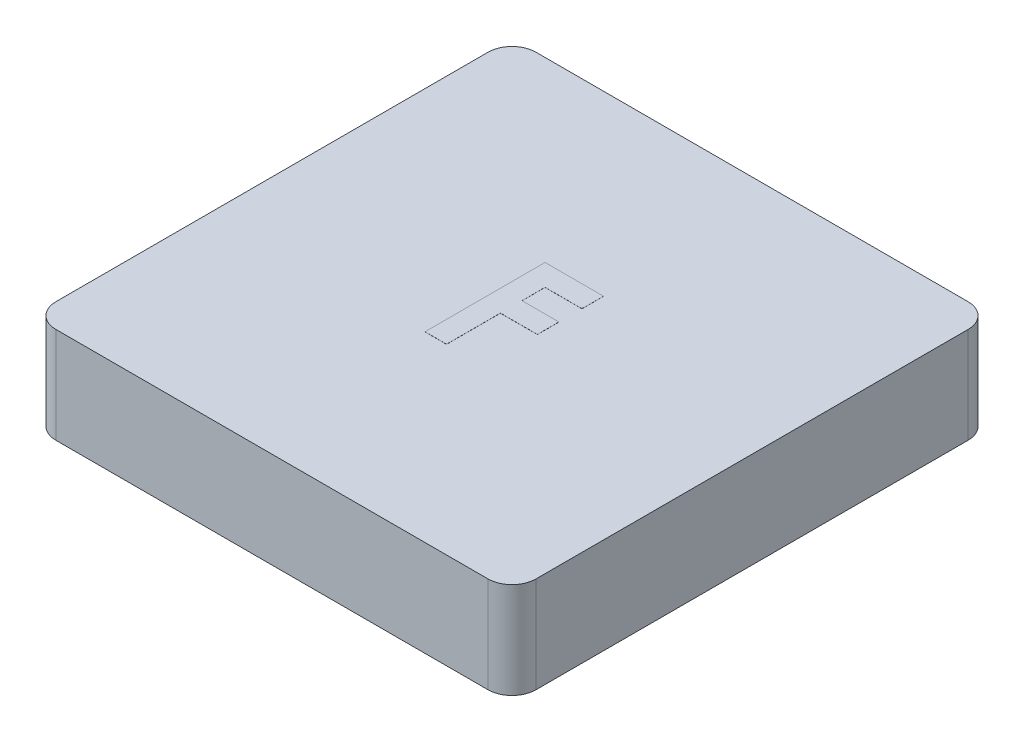
from build123d import *

# Parameters (mm, degrees)
SKETCH1_W           = 12.7
SKETCH1_H           = 12.7
BOSS_EXTRUDE1_DEPTH = 2.54
FILLET1_R           = 0.635
SHELL1_START        = 0.635
SHELL1_OUTLINE_W    = 1.905
SHELL1_OUTLINE_H    = 11.43
SHELL1_DEPTH        = 11.43
SKETCH2_R           = 2.54
BOSS_EXTRUDE2_DEPTH = 1.905
BOSS_EXTRUDE3_DEPTH = 0.00254


# Read off the part's stored shape, not the designer's step: Shell1
with BuildPart() as part:
    # Sketch1 → Boss-Extrude1 (new body)
    with BuildSketch(Plane(origin=(0, 0, 0), x_dir=(1, 0, 0), z_dir=(0, 1, 0))):
        with Locations((6.35, 6.35)):
            Rectangle(SKETCH1_W, SKETCH1_H)
    extrude(amount=BOSS_EXTRUDE1_DEPTH)

    # Fillet1
    fillet1_edges = [part.edges().sort_by_distance(p)[0] for p in [
        (0, 1.27, -12.7),
        (12.7, 1.27, -12.7),
        (12.7, 1.27, 0),
        (0, 1.27, 0),
    ]]
    fillet(fillet1_edges, radius=FILLET1_R)

    # Shell1 outline → Shell1 (cut)
    with BuildSketch(Plane.YZ.offset(SHELL1_START)):
        with Locations((0.9525, -6.35)):
            Rectangle(SHELL1_OUTLINE_W, SHELL1_OUTLINE_H)
    extrude(amount=SHELL1_DEPTH, mode=Mode.SUBTRACT)

    # Sketch2 → Boss-Extrude2 (add)
    with BuildSketch(Plane(origin=(0, 1.905, 0), x_dir=(-1, 0, 0), z_dir=(0, -1, 0))):
        with Locations(Location((-6.35, 6.35, 0), (0, 0, 270))):
            Circle(SKETCH2_R)
    extrude(amount=BOSS_EXTRUDE2_DEPTH)

    # Sketch3 → Boss-Extrude3 (add)
    with BuildSketch(Plane(origin=(0, 2.54, 0), x_dir=(1, 0, 0), z_dir=(0, 1, 0))):
        Polygon((5.573346154, 8.001), (7.120141026, 8.001), (7.120141026, 7.431128205), (6.143217949, 7.431128205), (6.143217949, 6.820551282), (7.120141026, 6.820551282), (7.120141026, 6.250679487), (6.143217949, 6.250679487), (6.143217949, 4.826), (5.573346154, 4.826), align=None)
    extrude(amount=BOSS_EXTRUDE3_DEPTH)


solid = part.part
